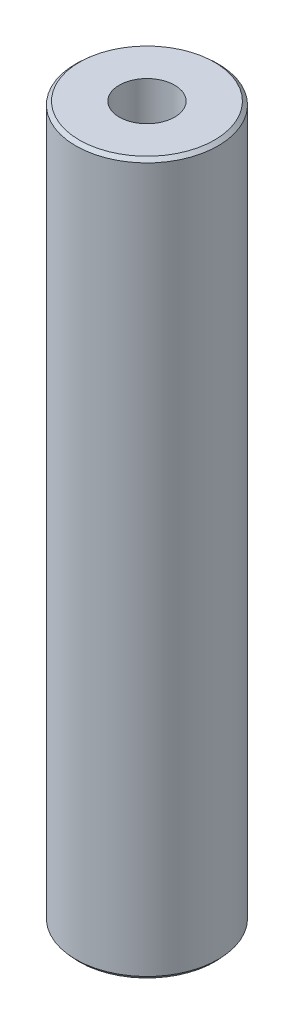
from build123d import *
from OCP.BRepFilletAPI import BRepFilletAPI_MakeChamfer

# Parameters (mm, degrees)
SKETCH1_R           = 60
BOSS_EXTRUDE1_DEPTH = 600
SKETCH2_R           = 23.364148418
CUT_EXTRUDE1_DEPTH  = 606.970296302
CHAMFER1_SIZE       = 2.716675981
CHAMFER1_SIZE2      = 3.048362308


with BuildPart() as part:
    # Sketch1 → Boss-Extrude1 (new body)
    with BuildSketch(Plane(origin=(0, 0, 0), x_dir=(1, 0, 0), z_dir=(0, 1, 0))):
        Circle(SKETCH1_R)
    extrude(amount=BOSS_EXTRUDE1_DEPTH)

    # Sketch2 → Cut-Extrude1 (cut, through all)
    with BuildSketch(Plane(origin=(0, 0, 0), x_dir=(1, 0, 0), z_dir=(0, 1, 0))):
        Circle(SKETCH2_R)
    extrude(amount=CUT_EXTRUDE1_DEPTH, mode=Mode.SUBTRACT)

    # Chamfer1: one chamfer whose edges measure the first distance from different faces: ONE call of the kernel's chamfer builder (chamfer() names one face for all edges)
    chamfer1_edges_1 = [part.edges().sort_by_distance(p)[0] for p in [
        (-60, 600, 0),
    ]]
    chamfer1_side_1 = [part.faces().sort_by_distance(p)[0] for p in [
        (-60, 300, 0),
    ]]
    chamfer1_edges_2 = [part.edges().sort_by_distance(p)[0] for p in [
        (-60, 0, 0),
    ]]
    chamfer1_side_2 = [part.faces().sort_by_distance(p)[0] for p in [
        (-58.302943725, 0, 0),
    ]]
    chamfer1 = BRepFilletAPI_MakeChamfer(part.part.solid().wrapped)
    for e in chamfer1_edges_1:
        chamfer1.Add(CHAMFER1_SIZE, CHAMFER1_SIZE2, e.wrapped, chamfer1_side_1[0].wrapped)  # the first distance lies on this face
    for e in chamfer1_edges_2:
        chamfer1.Add(CHAMFER1_SIZE, CHAMFER1_SIZE2, e.wrapped, chamfer1_side_2[0].wrapped)  # the first distance lies on this face
    add(Compound.cast(chamfer1.Shape()), mode=Mode.REPLACE)


solid = part.part
